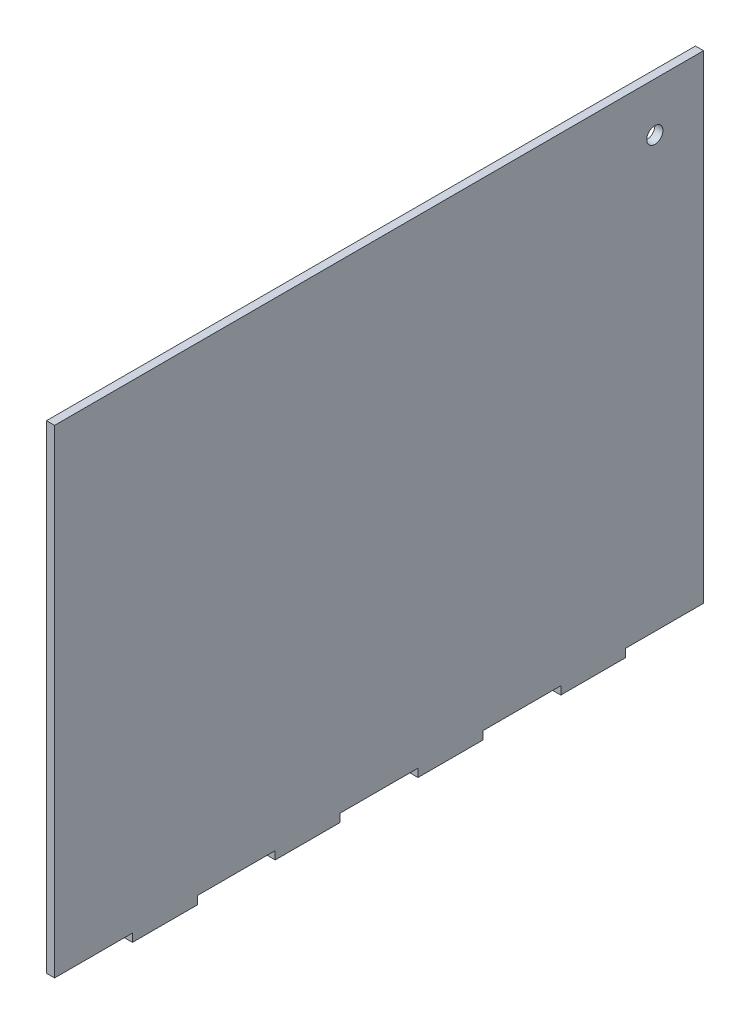
from build123d import *

# Parameters (mm, degrees)
SKIZZE1_W                  = 400
SKIZZE1_H                  = 300
GRUNDPLATTE_DEPTH          = 5
SKIZZE2_W                  = 48
SKIZZE2_H                  = 5
ZAPFEN_BODEN_DEPTH         = 361.589794642
SKIZZE3_R                  = 5
VERBINDUNGSBOHRUNGEN_DEPTH = 361.589794642


with BuildPart() as part:
    # Skizze1 → Grundplatte (new body)
    with BuildSketch(Plane(origin=(0, 0, 0), x_dir=(0, 0, -1), z_dir=(1, 0, 0))):
        with Locations((0, 150)):
            Rectangle(SKIZZE1_W, SKIZZE1_H)
    extrude(amount=GRUNDPLATTE_DEPTH)

    # Skizze2 → Zapfen Boden (cut, through all)
    with BuildSketch(Plane(origin=(5, 0, 0), x_dir=(0, 0, -1), z_dir=(1, 0, 0))):
        with Locations((-176, 2.5)):
            Rectangle(SKIZZE2_W, SKIZZE2_H)
        with Locations((-88, 2.5)):
            Rectangle(SKIZZE2_W, SKIZZE2_H)
        with Locations((0, 2.5)):
            Rectangle(SKIZZE2_W, SKIZZE2_H)
        with Locations((88, 2.5)):
            Rectangle(SKIZZE2_W, SKIZZE2_H)
        with Locations((176, 2.5)):
            Rectangle(SKIZZE2_W, SKIZZE2_H)
    extrude(amount=-ZAPFEN_BODEN_DEPTH, mode=Mode.SUBTRACT)

    # Skizze3 → Verbindungsbohrungen (cut, through all)
    with BuildSketch(Plane(origin=(5, 0, 0), x_dir=(0, 0, -1), z_dir=(1, 0, 0))):
        with Locations((170, 270)):
            Circle(SKIZZE3_R)
    extrude(amount=-VERBINDUNGSBOHRUNGEN_DEPTH, mode=Mode.SUBTRACT)


solid = part.part
